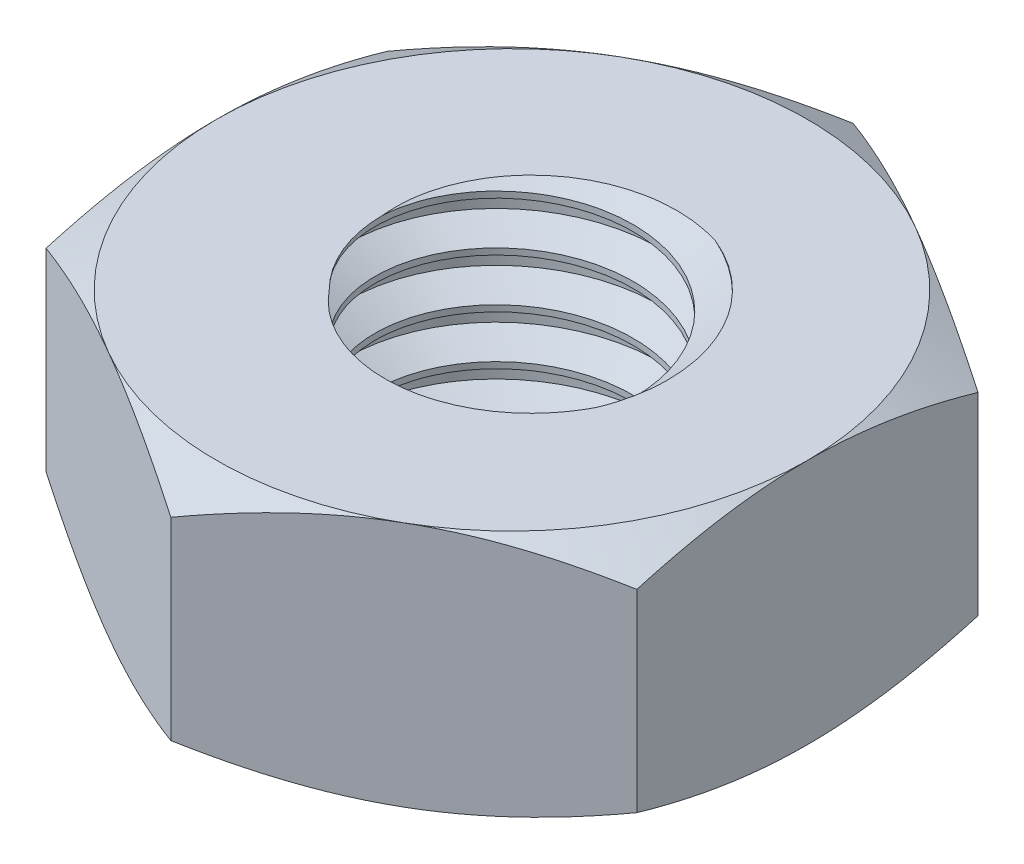
from build123d import *

# Parameters (mm, degrees)
BOSS_EXTRUDE1_DEPTH     = 5
M12X1_5_TAPPED_HOLE1_D  = 10.5
THREAD1_PITCH           = 2
SKETCH7_OUTSIDE_W       = 109.396
SKETCH7_OUTSIDE_H       = 113.108
SKETCH7_OUTSIDE_R       = 12
CUT_EXTRUDE1_DEPTH      = 21.88061319
CUT_EXTRUDE1_DRAFT      = -60
MIRROR1_COPY_1_SKETCH_W = 109.396
MIRROR1_COPY_1_SKETCH_H = 113.108
MIRROR1_COPY_1_SKETCH_R = 12
MIRROR1_COPY_1_DEPTH    = 21.88061319
MIRROR1_COPY_1_DRAFT    = -60


with BuildPart() as part:
    # Sketch1 → Boss-Extrude1 (new, symmetric)
    with BuildSketch(Plane(origin=(0, 0, 0), x_dir=(1, 0, 0), z_dir=(0, 1, 0))):
        Polygon((0, 13.856406461), (-12, 6.92820323), (-12, -6.92820323), (0, -13.856406461), (12, -6.92820323), (12, 6.92820323), align=None)
    extrude(amount=BOSS_EXTRUDE1_DEPTH, both=True)

    # M12x1.5 Tapped Hole1 (through all)
    with Locations(Plane(origin=(0, -5, 0), x_dir=(-1, 0, 0), z_dir=(0, -1, 0))):
        with Locations((0, 0)):
            Hole(M12X1_5_TAPPED_HOLE1_D / 2)

    # Thread1: the profile of Thread Profile1 profile screwed along a right-hand helix of 20 turns, 10 arcs to a turn; built about Z, then put on its axis
    thread1_z = Axis((0, 0, 0), (0, 0, 1))
    thread1_corners = [(5.2497, 0, -0.000173205), (5.2497, 0, 1.7501732), (6.33253175, 0, 1.124999997), (6.33253175, 0, 0.624999997)]
    with BuildLine(mode=Mode.PRIVATE) as thread1_profile:
        Line(thread1_corners[0], thread1_corners[1])
        Line(thread1_corners[1], thread1_corners[2])
        Line(thread1_corners[2], thread1_corners[3])
        Line(thread1_corners[3], thread1_corners[0])
    thread1_cap = Face(thread1_profile.wire())
    thread1_turn_angles = [0, 18, 36, 54, 72, 90, 108, 126, 144, 162, 180, 198, 216, 234, 252, 270, 288, 306, 324, 342, 360]
    thread1_turn_weights = [1, 0.9510565162951535, 1, 0.9510565162951535, 1, 0.9510565162951535, 1, 0.9510565162951535, 1, 0.9510565162951535, 1, 0.9510565162951535, 1, 0.9510565162951535, 1, 0.9510565162951535, 1, 0.9510565162951535, 1, 0.9510565162951535, 1]
    thread1_turn_rails = [Edge.make_bspline([Vector(p[0], p[1], 0).rotate(thread1_z, thread1_turn_angles[k]) / thread1_turn_weights[k] + Vector(0, 0, p[2] + THREAD1_PITCH * thread1_turn_angles[k] / 360) for k in range(21)], [0, 0, 0, 1, 1, 2, 2, 3, 3, 4, 4, 5, 5, 6, 6, 7, 7, 8, 8, 9, 9, 10, 10, 10], 2, thread1_turn_weights) for p in thread1_corners]
    thread1_turn_sides = [Face.make_surface_from_curves(thread1_turn_rails[p[0]], thread1_turn_rails[p[1]]) for p in [(0, 1), (1, 2), (2, 3), (3, 0)]]
    thread1 = Plane(origin=(0, -10, 0), x_dir=(1, 0, 0), z_dir=(0, 1, 0)) * Solid(Shell([*[p.moved(Location((0, 0, THREAD1_PITCH * i))) for i in range(20) for p in thread1_turn_sides], thread1_cap, thread1_cap.rotate(thread1_z, 7200).moved(Location((0, 0, THREAD1_PITCH * 7200 / 360)))]))
    add(thread1, mode=Mode.SUBTRACT)


with BuildPart() as cut_extrude1_tool:
    # Sketch7 outside → Cut-Extrude1 (with draft: the straight prism first)
    with BuildSketch(Plane.XZ.offset(5)):
        Rectangle(SKETCH7_OUTSIDE_W, SKETCH7_OUTSIDE_H)
        Circle(SKETCH7_OUTSIDE_R, mode=Mode.SUBTRACT)
    extrude(amount=-CUT_EXTRUDE1_DEPTH)
    # Cut-Extrude1: the draft: its side faces are tilted about the plane it starts from
    cut_extrude1_sides = [cut_extrude1_tool.faces().sort_by_distance(p)[0] for p in [
        (0, 5.940306595, -56.554),
        (54.698, 5.940306595, 0),
        (0, 5.940306595, 56.554),
        (-54.698, 5.940306595, 0),
        (-12, 5.940306595, 0),
    ]]
    draft(cut_extrude1_sides, Plane.XZ.offset(5), CUT_EXTRUDE1_DRAFT)


with BuildPart() as part_1:
    add(part.part)

    # Cut-Extrude1: cut by cut_extrude1_tool
    add(cut_extrude1_tool.part, mode=Mode.SUBTRACT)


with BuildPart() as mirror1_copy_1_tool:
    # Mirror1 copy 1 sketch → Mirror1 copy 1 (with draft: the straight prism first)
    with BuildSketch(Plane(origin=(0, 5, 0), x_dir=(1, 0, 0), z_dir=(0, 1, 0))):
        Rectangle(MIRROR1_COPY_1_SKETCH_W, MIRROR1_COPY_1_SKETCH_H)
        Circle(MIRROR1_COPY_1_SKETCH_R, mode=Mode.SUBTRACT)
    extrude(amount=-MIRROR1_COPY_1_DEPTH)
    # Mirror1 copy 1: the draft: its side faces are tilted about the plane it starts from
    mirror1_copy_1_sides = [mirror1_copy_1_tool.faces().sort_by_distance(p)[0] for p in [
        (0, -5.940306595, -56.554),
        (54.698, -5.940306595, 0),
        (0, -5.940306595, 56.554),
        (-54.698, -5.940306595, 0),
        (-12, -5.940306595, 0),
    ]]
    draft(mirror1_copy_1_sides, Plane(origin=(0, 5, 0), x_dir=(1, 0, 0), z_dir=(0, 1, 0)), MIRROR1_COPY_1_DRAFT)


with BuildPart() as part_2:
    add(part_1.part)

    # Mirror1 copy 1: cut by mirror1_copy_1_tool
    add(mirror1_copy_1_tool.part, mode=Mode.SUBTRACT)


solid = part_2.part
